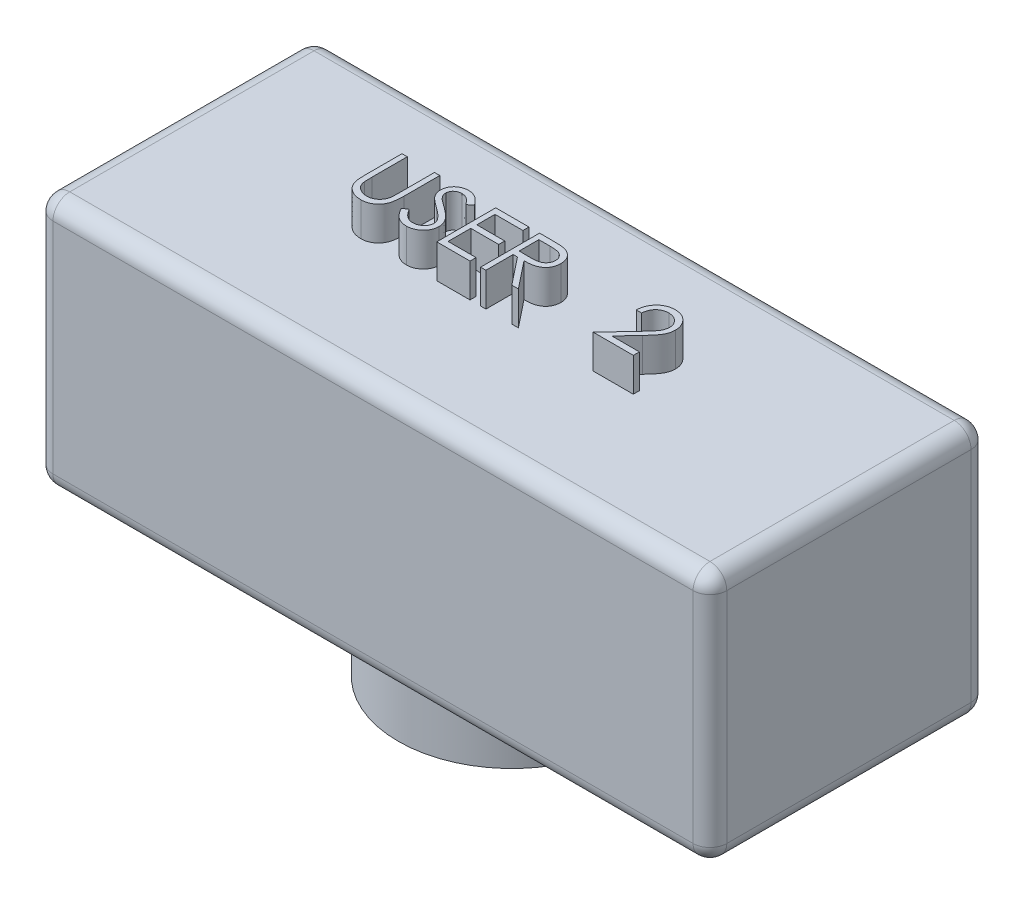
from build123d import *

# Parameters (mm, degrees)
SKETCH1_R           = 5.75
BOSS_EXTRUDE1_DEPTH = 4.5
SKETCH2_W           = 40
SKETCH2_H           = 16.5
BOSS_EXTRUDE2_DEPTH = 15
SKETCH3_R           = 6.75
BOSS_EXTRUDE3_DEPTH = 4
SKETCH5_R           = 5.75
CUT_EXTRUDE1_DEPTH  = 4
FILLET1_R           = 1
BOSS_EXTRUDE5_DEPTH = 2
FILLET2_R           = 1


with BuildPart() as part:
    # Sketch1 → Boss-Extrude1 (new body)
    with BuildSketch(Plane(origin=(0, 0, 0), x_dir=(1, 0, 0), z_dir=(0, 1, 0))):
        with Locations(Location((0, 0, 0), (0, 0, 270))):
            Circle(SKETCH1_R)
    extrude(amount=BOSS_EXTRUDE1_DEPTH)

    # Sketch2 → Boss-Extrude2 (add)
    with BuildSketch(Plane(origin=(0, 4.5, 0), x_dir=(1, 0, 0), z_dir=(0, 1, 0))):
        Rectangle(SKETCH2_W, SKETCH2_H)
    extrude(amount=BOSS_EXTRUDE2_DEPTH)

    # Sketch3 → Boss-Extrude3 (add)
    with BuildSketch(Plane.XZ.offset(-4.5)):
        with Locations(Location((0, 0, 0), (0, 0, 90))):
            Circle(SKETCH3_R)
    extrude(amount=BOSS_EXTRUDE3_DEPTH)

    # Sketch5 → Cut-Extrude1 (cut)
    with BuildSketch(Plane.XZ):
        with Locations(Location((0, 0, 0), (0, 0, 270))):
            Circle(SKETCH5_R)
    extrude(amount=-CUT_EXTRUDE1_DEPTH, mode=Mode.SUBTRACT)

    # Fillet1
    fillet1_edges = [part.edges().sort_by_distance(p)[0] for p in [
        (20, 19.5, 0),
        (0, 19.5, -8.25),
        (-20, 19.5, 0),
        (0, 19.5, 8.25),
    ]]
    fillet(fillet1_edges, radius=FILLET1_R)

    # Sketch9 → Boss-Extrude5 (add)
    # profile 1 of 5: a face of its own
    with BuildSketch(Plane(origin=(0, 19.5, 0), x_dir=(1, 0, 0), z_dir=(0, 1, 0))):
        with BuildLine():
            Line((-9.101327965, 2.570923135), (-8.787225401, 2.570923135))
            Line((-8.787225401, 2.570923135), (-8.787225401, 0.473867847))
            add(Edge.make_bspline(
                [(-8.787225401, 0.473867847), (-8.787272145, 0.444187111), (-8.78736085, 0.3878628), (-8.786768336, 0.307694499), (-8.785108967, 0.23642204), (-8.784062808, 0.173770693), (-8.781735474, 0.120027945), (-8.779837427, 0.074902635), (-8.777396871, 0.038608432), (-8.774463753, 0.017427506), (-8.773202965, 0.008322975)],
                knots=[0, 0, 0, 0, 1.528628734, 2.90083645, 4.128790002, 5.200304208, 6.127813768, 6.898992206, 7.526736466, 8, 8, 8, 8], degree=3))
            add(Edge.make_bspline(
                [(-8.773202965, 0.008322975), (-8.768025506, -0.024523789), (-8.75796232, -0.088366518), (-8.732315942, -0.179274799), (-8.696498441, -0.261206258), (-8.654055398, -0.336717549), (-8.598122787, -0.403706909), (-8.531119252, -0.465418562), (-8.449941483, -0.519390366), (-8.359680877, -0.568741178), (-8.26239564, -0.608406261), (-8.162984374, -0.638399625), (-8.062941394, -0.656678525), (-7.995965229, -0.658795064), (-7.96270617, -0.659846096)],
                knots=[0, 0, 0, 0, 1.035780045, 2.013197591, 2.933192213, 3.817615948, 4.702609284, 5.640816605, 6.646850145, 7.73207398, 8.84249596, 9.914020372, 10.964143139, 12, 12, 12, 12], degree=3))
            add(Edge.make_bspline(
                [(-7.96270617, -0.659846096), (-7.93415243, -0.658772245), (-7.877209868, -0.656630747), (-7.792603437, -0.643369316), (-7.710203328, -0.61946875), (-7.629602649, -0.588628992), (-7.554051664, -0.547881401), (-7.483508222, -0.500810561), (-7.420544288, -0.445599685), (-7.36308629, -0.384499341), (-7.313051354, -0.315559541), (-7.269680213, -0.240281403), (-7.234154283, -0.157532056), (-7.216610758, -0.099377634), (-7.207597997, -0.069501544)],
                knots=[0, 0, 0, 0, 0.994687771, 1.983630487, 2.973142513, 3.978332533, 4.983357753, 5.956394766, 6.925816176, 7.893390482, 8.871859704, 9.88551698, 10.913711441, 12, 12, 12, 12], degree=3))
            add(Edge.make_bspline(
                [(-7.207597997, -0.069501544), (-7.204597872, -0.05715297), (-7.197912384, -0.02963537), (-7.191665339, 0.016885921), (-7.185158813, 0.071775285), (-7.180644243, 0.135427097), (-7.176243023, 0.20762807), (-7.17360995, 0.288754327), (-7.172392917, 0.378511288), (-7.172030237, 0.44114845), (-7.171840785, 0.473867847)],
                knots=[0, 0, 0, 0, 0.558680831, 1.244966039, 2.062412453, 2.990489873, 4.051219941, 5.244515665, 6.560634259, 8, 8, 8, 8], degree=3))
            Line((-7.171840785, 0.473867847), (-7.171840785, 2.570923135))
            Line((-7.171840785, 2.570923135), (-6.857738221, 2.570923135))
            Line((-6.857738221, 2.570923135), (-6.857738221, 0.457040924))
            add(Edge.make_bspline(
                [(-6.857738221, 0.457040924), (-6.857992342, 0.418942545), (-6.858488273, 0.344591242), (-6.86278885, 0.235639883), (-6.869645849, 0.132286901), (-6.879333937, 0.034518405), (-6.892170941, -0.057315754), (-6.906446161, -0.144020523), (-6.924625694, -0.224973515), (-6.945859095, -0.300805933), (-6.970132643, -0.372991446), (-7.001573792, -0.441500061), (-7.036998292, -0.508414461), (-7.079012945, -0.572722569), (-7.126224327, -0.634709123), (-7.179676008, -0.693998198), (-7.237600169, -0.751537244), (-7.300959728, -0.80585031), (-7.368710254, -0.855658987), (-7.440650211, -0.899456758), (-7.516226981, -0.936480375), (-7.595244107, -0.9669563), (-7.67773531, -0.989870899), (-7.76370267, -1.006946055), (-7.853341863, -1.016648352), (-7.914306519, -1.018090282), (-7.945178125, -1.018820455)],
                knots=[0, 0, 0, 0, 1.316592851, 2.569410997, 3.76748051, 4.895814652, 5.963796859, 6.97159953, 7.931736103, 8.829262218, 9.692595152, 10.560224239, 11.431080259, 12.30701507, 13.211635791, 14.121146779, 15.063487852, 16.031507147, 17.00238618, 17.966455255, 18.938106653, 19.907068911, 20.888905087, 21.893141452, 22.933117798, 24, 24, 24, 24], degree=3))
            add(Edge.make_bspline(
                [(-7.945178125, -1.018820455), (-7.978847228, -1.018035689), (-8.044905887, -1.016495983), (-8.142243954, -1.007673233), (-8.23555815, -0.991054838), (-8.325834027, -0.969894895), (-8.411842524, -0.940711157), (-8.494735969, -0.906613032), (-8.57309465, -0.864735772), (-8.648189779, -0.818142379), (-8.718014535, -0.765717741), (-8.782111938, -0.708577567), (-8.840587808, -0.64763719), (-8.892456505, -0.582236824), (-8.938577389, -0.512885117), (-8.978307603, -0.439385877), (-9.012420847, -0.361767561), (-9.030027414, -0.30781436), (-9.038928125, -0.280539205)],
                knots=[0, 0, 0, 0, 1.13879206, 2.234305948, 3.301075583, 4.341971843, 5.366689343, 6.369221514, 7.369726634, 8.367512178, 9.355451585, 10.318319045, 11.268648973, 12.207971039, 13.137398894, 14.081662264, 15.030215811, 16, 16, 16, 16], degree=3))
            add(Edge.make_bspline(
                [(-9.038928125, -0.280539205), (-9.044105283, -0.26190663), (-9.055334655, -0.221492161), (-9.067359952, -0.154605673), (-9.077469034, -0.077590755), (-9.086974592, 0.009557863), (-9.09258355, 0.10690773), (-9.097500989, 0.214416646), (-9.101362608, 0.332214607), (-9.101339835, 0.414269123), (-9.101327965, 0.457040924)],
                knots=[0, 0, 0, 0, 0.625038921, 1.35572334, 2.194682327, 3.136881307, 4.189498639, 5.346923369, 6.617055217, 8, 8, 8, 8], degree=3))
            Line((-9.101327965, 0.457040924), (-9.101327965, 2.570923135))
        make_face()
    # profile 2 of 5: a face of its own
    with BuildSketch(Plane(origin=(0, 19.5, 0), x_dir=(1, 0, 0), z_dir=(0, 1, 0))):
        with BuildLine():
            Line((-6.319276683, -0.253896576), (-6.023403285, -0.076512762))
            add(Edge.make_bspline(
                [(-6.023403285, -0.076512762), (-5.995885048, -0.122577147), (-5.943161168, -0.210834731), (-5.855209808, -0.330092772), (-5.764076897, -0.431454928), (-5.669087564, -0.514331536), (-5.570821616, -0.579580423), (-5.468637562, -0.625782654), (-5.362879751, -0.65459863), (-5.29090593, -0.658098716), (-5.254973798, -0.659846096)],
                knots=[0, 0, 0, 0, 1.272034388, 2.437168799, 3.508375237, 4.49857839, 5.41946034, 6.295179144, 7.148887113, 8, 8, 8, 8], degree=3))
            add(Edge.make_bspline(
                [(-5.254973798, -0.659846096), (-5.224286938, -0.658991423), (-5.163450165, -0.657297033), (-5.073887922, -0.641016231), (-4.98690612, -0.616004102), (-4.904297482, -0.58018317), (-4.827201867, -0.536844685), (-4.759595172, -0.484498507), (-4.701149059, -0.425892301), (-4.653339944, -0.360509647), (-4.616659909, -0.290192498), (-4.58846784, -0.218016547), (-4.572822767, -0.142847979), (-4.570466013, -0.092237516), (-4.569276683, -0.066697057)],
                knots=[0, 0, 0, 0, 1.095163259, 2.171163733, 3.241058638, 4.321873601, 5.38011039, 6.391990106, 7.366004449, 8.327778327, 9.272591725, 10.192022065, 11.087607919, 12, 12, 12, 12], degree=3))
            add(Edge.make_bspline(
                [(-4.569276683, -0.066697057), (-4.570750994, -0.037556208), (-4.573748052, 0.021682882), (-4.599079532, 0.109082535), (-4.638928779, 0.195575105), (-4.675691422, 0.24907637), (-4.694777484, 0.276852622)],
                knots=[0, 0, 0, 0, 0.938893495, 1.908633276, 2.914225137, 4, 4, 4, 4], degree=3))
            add(Edge.make_bspline(
                [(-4.694777484, 0.276852622), (-4.710448098, 0.296899446), (-4.743346593, 0.338985244), (-4.799904105, 0.40163048), (-4.86627022, 0.466248899), (-4.940173774, 0.535307956), (-5.024306863, 0.605595753), (-5.116034378, 0.68046403), (-5.217698237, 0.757065607), (-5.288997733, 0.808438173), (-5.3257871, 0.834945571)],
                knots=[0, 0, 0, 0, 0.722233717, 1.516239348, 2.393582979, 3.351407094, 4.387010283, 5.505090956, 6.712668013, 8, 8, 8, 8], degree=3))
            add(Edge.make_bspline(
                [(-5.3257871, 0.834945571), (-5.362611096, 0.861174159), (-5.433015772, 0.911321221), (-5.531474355, 0.985745505), (-5.619518818, 1.053789374), (-5.696757834, 1.116093387), (-5.763157431, 1.172665991), (-5.819240842, 1.22296393), (-5.863579399, 1.268347491), (-5.88823498, 1.297788833), (-5.899304728, 1.31100727)],
                knots=[0, 0, 0, 0, 1.452282411, 2.77665338, 3.964542531, 5.026858415, 5.96415736, 6.766646006, 7.446254459, 8, 8, 8, 8], degree=3))
            add(Edge.make_bspline(
                [(-5.899304728, 1.31100727), (-5.914777273, 1.331608307), (-5.94520611, 1.37212301), (-5.985372115, 1.435447868), (-6.019511278, 1.500271134), (-6.04627361, 1.566766998), (-6.068809829, 1.634001927), (-6.08396776, 1.702853173), (-6.093459157, 1.773011791), (-6.094431143, 1.820225292), (-6.094917709, 1.843859834)],
                knots=[0, 0, 0, 0, 1.068054152, 2.10047183, 3.106115577, 4.101338837, 5.06977816, 6.043150881, 7.020423561, 8, 8, 8, 8], degree=3))
            add(Edge.make_bspline(
                [(-6.094917709, 1.843859834), (-6.0936125, 1.880889608), (-6.091029979, 1.954157672), (-6.069189462, 2.061188503), (-6.034716569, 2.16337492), (-5.986421681, 2.259705253), (-5.924164328, 2.347671234), (-5.852118353, 2.428284721), (-5.766306867, 2.496053304), (-5.672154244, 2.555265362), (-5.569097872, 2.601611287), (-5.461106968, 2.636572267), (-5.348009896, 2.656381525), (-5.271406762, 2.65922429), (-5.232537901, 2.660666725)],
                knots=[0, 0, 0, 0, 1.005424448, 1.989358655, 2.955360095, 3.929531133, 4.905563448, 5.876582895, 6.856512386, 7.866279853, 8.892233794, 9.918561126, 10.94386622, 12, 12, 12, 12], degree=3))
            add(Edge.make_bspline(
                [(-5.232537901, 2.660666725), (-5.191293801, 2.659244173), (-5.109272449, 2.656415172), (-4.988623233, 2.631817641), (-4.872462517, 2.591116969), (-4.779019252, 2.544928311), (-4.705886491, 2.498796895), (-4.650113758, 2.456777071), (-4.593596307, 2.408401962), (-4.535878252, 2.353542716), (-4.477937593, 2.291695965), (-4.418914141, 2.223285276), (-4.358669872, 2.148728721), (-4.319914012, 2.09550422), (-4.300045914, 2.068218808)],
                knots=[0, 0, 0, 0, 1.286793592, 2.559021753, 3.825965368, 5.121522368, 5.803751409, 6.523245864, 7.299691795, 8.125521123, 9.008227632, 9.944561021, 10.946284179, 12, 12, 12, 12], degree=3))
            Line((-4.300045914, 2.068218808), (-4.584000241, 1.852974417))
            add(Edge.make_bspline(
                [(-4.584000241, 1.852974417), (-4.601146173, 1.875063108), (-4.63416523, 1.917600761), (-4.684294717, 1.977172076), (-4.731543365, 2.031588556), (-4.778093765, 2.078853684), (-4.821487396, 2.121555817), (-4.863604438, 2.158115574), (-4.90383879, 2.18889117), (-4.9545557, 2.22173473), (-5.018273419, 2.254291233), (-5.098257955, 2.281840311), (-5.18184423, 2.298395373), (-5.238773861, 2.300584261), (-5.267593991, 2.301692366)],
                knots=[0, 0, 0, 0, 1.181633172, 2.275549214, 3.290209073, 4.226197932, 5.078386478, 5.862611352, 6.581680152, 7.217281963, 8.414376989, 9.595101626, 10.782541182, 12, 12, 12, 12], degree=3))
            add(Edge.make_bspline(
                [(-5.267593991, 2.301692366), (-5.303750513, 2.300480666), (-5.37347496, 2.298144017), (-5.472465197, 2.272624031), (-5.561559122, 2.232442171), (-5.638111687, 2.176127193), (-5.701848664, 2.1094062), (-5.747954122, 2.032627345), (-5.775704287, 1.947844943), (-5.779090567, 1.888703286), (-5.780815144, 1.858583392)],
                knots=[0, 0, 0, 0, 1.14458467, 2.207223713, 3.21896685, 4.227309161, 5.202851033, 6.127160689, 7.046193047, 8, 8, 8, 8], degree=3))
            add(Edge.make_bspline(
                [(-5.780815144, 1.858583392), (-5.780422018, 1.839831913), (-5.779635122, 1.802298294), (-5.768660324, 1.746846872), (-5.754560995, 1.691535532), (-5.732218363, 1.636612949), (-5.70137306, 1.58111859), (-5.660867884, 1.524096853), (-5.609854572, 1.465045144), (-5.570777559, 1.42663777), (-5.550146074, 1.406359834)],
                knots=[0, 0, 0, 0, 0.858281714, 1.717966888, 2.583508476, 3.4729293, 4.427298488, 5.488583878, 6.674047936, 8, 8, 8, 8], degree=3))
            add(Edge.make_bspline(
                [(-5.550146074, 1.406359834), (-5.542484702, 1.399522808), (-5.524283034, 1.3832796), (-5.491007109, 1.356687319), (-5.44706431, 1.323884547), (-5.393602109, 1.28329723), (-5.329634748, 1.236215768), (-5.255155191, 1.183242156), (-5.170993659, 1.122656697), (-5.111271743, 1.080299156), (-5.07969335, 1.057902302)],
                knots=[0, 0, 0, 0, 0.420754252, 0.999615792, 1.744751191, 2.668019286, 3.750313428, 4.999500688, 6.413464383, 8, 8, 8, 8], degree=3))
            add(Edge.make_bspline(
                [(-5.07969335, 1.057902302), (-5.041707436, 1.030260942), (-4.96815298, 0.97673728), (-4.8634954, 0.8963216), (-4.768601592, 0.817673832), (-4.683138388, 0.741296225), (-4.60626148, 0.667768132), (-4.538823759, 0.596204951), (-4.480138079, 0.527119379), (-4.41695886, 0.438546803), (-4.352401041, 0.329765719), (-4.296959533, 0.19648748), (-4.262001186, 0.06269116), (-4.257429671, -0.027235677), (-4.255174119, -0.07160491)],
                knots=[0, 0, 0, 0, 1.163667725, 2.253281268, 3.268753668, 4.215851969, 5.092017293, 5.902905408, 6.650798638, 7.335211899, 8.59617414, 9.77448103, 10.901945474, 12, 12, 12, 12], degree=3))
            add(Edge.make_bspline(
                [(-4.255174119, -0.07160491), (-4.255831257, -0.102983275), (-4.257132772, -0.165130658), (-4.272093686, -0.256385735), (-4.294013351, -0.345016605), (-4.327050585, -0.429927717), (-4.367373743, -0.51267248), (-4.418539991, -0.591080381), (-4.477847676, -0.666886779), (-4.545881441, -0.73807027), (-4.620327343, -0.803416466), (-4.699011038, -0.861545528), (-4.782061311, -0.910013851), (-4.869027627, -0.949564693), (-4.959929964, -0.980498211), (-5.054737748, -1.00291108), (-5.153607259, -1.016666791), (-5.220807741, -1.018094552), (-5.254973798, -1.018820455)],
                knots=[0, 0, 0, 0, 0.983748083, 1.948392443, 2.894712957, 3.844097841, 4.80183111, 5.778335162, 6.776009319, 7.81870978, 8.863265674, 9.881300176, 10.883814829, 11.87499822, 12.874611388, 13.892143829, 14.928324115, 16, 16, 16, 16], degree=3))
            add(Edge.make_bspline(
                [(-5.254973798, -1.018820455), (-5.281409141, -1.018309273), (-5.333946901, -1.017293348), (-5.411656383, -1.008312067), (-5.487795972, -0.995604964), (-5.561410254, -0.975430894), (-5.633447666, -0.950953917), (-5.703594901, -0.920815584), (-5.771885954, -0.884698383), (-5.838703537, -0.843403358), (-5.903877712, -0.795345613), (-5.96679718, -0.739372117), (-6.029526365, -0.677026612), (-6.090213762, -0.606616049), (-6.150086906, -0.529277966), (-6.207965316, -0.444288782), (-6.265047033, -0.352111429), (-6.300862501, -0.287246343), (-6.319276683, -0.253896576)],
                knots=[0, 0, 0, 0, 0.915332311, 1.819136955, 2.706846663, 3.586547465, 4.459518054, 5.340707479, 6.227863349, 7.133153174, 8.059268498, 9.028702269, 10.047606654, 11.120612155, 12.245963614, 13.433783089, 14.680604001, 16, 16, 16, 16], degree=3))
        make_face()
    # profile 3 of 5: a face of its own
    with BuildSketch(Plane(origin=(0, 19.5, 0), x_dir=(1, 0, 0), z_dir=(0, 1, 0))):
        Polygon((-3.537225401, 2.570923135), (-1.562866427, 2.570923135), (-1.562866427, 2.211948776), (-3.223122837, 2.211948776), (-3.223122837, 1.135025699), (-1.562866427, 1.135025699), (-1.562866427, 0.77605134), (-3.223122837, 0.77605134), (-3.223122837, -0.570102506), (-1.562866427, -0.570102506), (-1.562866427, -0.929076865), (-3.537225401, -0.929076865), align=None)
    # profile 4 of 5: a face of its own
    with BuildSketch(Plane(origin=(0, 19.5, 0), x_dir=(1, 0, 0), z_dir=(0, 1, 0))):
        with BuildLine():
            Line((-0.934661298, 2.570923135), (-0.234240625, 2.570923135))
            add(Edge.make_bspline(
                [(-0.234240625, 2.570923135), (-0.187499497, 2.570767549), (-0.097751352, 2.570468807), (0.030821918, 2.568803044), (0.147649015, 2.564028688), (0.252668854, 2.559920105), (0.345879509, 2.552428163), (0.4275668, 2.545267516), (0.497354498, 2.535893855), (0.539600349, 2.527188432), (0.558728125, 2.523246853)],
                knots=[0, 0, 0, 0, 1.410062039, 2.707475311, 3.878576406, 4.937260626, 5.877586885, 6.699081471, 7.410979367, 8, 8, 8, 8], degree=3))
            add(Edge.make_bspline(
                [(0.558728125, 2.523246853), (0.584334749, 2.516920088), (0.635001738, 2.504401524), (0.707951804, 2.477941923), (0.777466128, 2.447322299), (0.843255953, 2.411358578), (0.904991744, 2.369783799), (0.963310055, 2.323315676), (1.018475518, 2.27220847), (1.068257148, 2.215173629), (1.1151962, 2.155337119), (1.154784826, 2.090633362), (1.188911306, 2.022971835), (1.216081823, 1.951664417), (1.237959797, 1.877402645), (1.253386036, 1.799513848), (1.262637224, 1.718352873), (1.263579079, 1.662994965), (1.26405665, 1.634925539)],
                knots=[0, 0, 0, 0, 1.027469482, 2.033020251, 3.019912614, 3.986113645, 4.951240523, 5.91722682, 6.890402269, 7.87763091, 8.8651537, 9.85103654, 10.82876324, 11.815024772, 12.821070561, 13.842952187, 14.906261191, 16, 16, 16, 16], degree=3))
            add(Edge.make_bspline(
                [(1.26405665, 1.634925539), (1.262587652, 1.588290434), (1.259721257, 1.497293266), (1.232996153, 1.365232385), (1.189219633, 1.24204307), (1.128896344, 1.127880432), (1.052076868, 1.024969787), (0.959752077, 0.934579332), (0.851870466, 0.858939419), (0.75144115, 0.806486615), (0.66272695, 0.772893706), (0.589693637, 0.749257347), (0.51002666, 0.730995382), (0.424489325, 0.71463525), (0.33272567, 0.702283556), (0.23495563, 0.693236961), (0.131109479, 0.687582912), (0.059770409, 0.686740908), (0.023071073, 0.68630775)],
                knots=[0, 0, 0, 0, 1.260483769, 2.459530307, 3.627416485, 4.787058657, 5.939039949, 7.08810263, 8.267026773, 9.491475466, 10.141966685, 10.831826277, 11.566392101, 12.351337768, 13.187381173, 14.07005841, 15.007169909, 16, 16, 16, 16], degree=3))
            Line((0.023071073, 0.68630775), (1.308928445, -0.929076865))
            Line((1.308928445, -0.929076865), (0.920506971, -0.929076865))
            Line((0.920506971, -0.929076865), (-0.365350401, 0.68630775))
            Line((-0.365350401, 0.68630775), (-0.620558734, 0.68630775))
            Line((-0.620558734, 0.68630775), (-0.620558734, -0.929076865))
            Line((-0.620558734, -0.929076865), (-0.934661298, -0.929076865))
            Line((-0.934661298, -0.929076865), (-0.934661298, 2.570923135))
        make_face()
        with BuildLine():
            Line((-0.620558734, 2.211948776), (-0.620558734, 1.045282109))
            Line((-0.620558734, 1.045282109), (0.020266586, 1.040374257))
            add(Edge.make_bspline(
                [(0.020266586, 1.040374257), (0.050186625, 1.04036102), (0.108180182, 1.040335364), (0.192080847, 1.04432914), (0.270200959, 1.048872458), (0.342241711, 1.055821804), (0.408235286, 1.064777876), (0.4681487, 1.07598086), (0.522079751, 1.089032922), (0.58497829, 1.109234548), (0.655214821, 1.141240567), (0.731546281, 1.187806065), (0.796548619, 1.246375184), (0.851466481, 1.31334864), (0.895595913, 1.386984889), (0.926707967, 1.466401258), (0.946450409, 1.549592856), (0.948778955, 1.606770964), (0.949954086, 1.635626661)],
                knots=[0, 0, 0, 0, 1.146690395, 2.22261258, 3.21895312, 4.145990853, 4.996080663, 5.770904154, 6.481378293, 7.121626537, 8.300444488, 9.431385265, 10.535395872, 11.636531494, 12.74115979, 13.810798291, 14.895190096, 16, 16, 16, 16], degree=3))
            add(Edge.make_bspline(
                [(0.949954086, 1.635626661), (0.948751965, 1.663773234), (0.9463698, 1.719549473), (0.926921031, 1.801205383), (0.89403165, 1.878272334), (0.849709412, 1.950436819), (0.795710257, 2.015942554), (0.732392444, 2.071989707), (0.661487249, 2.118239172), (0.595216051, 2.147793553), (0.535981838, 2.165913406), (0.484552178, 2.17866457), (0.426440701, 2.188909039), (0.361365242, 2.1971171), (0.289603611, 2.204172044), (0.21079296, 2.208923822), (0.12545618, 2.211737687), (0.066309249, 2.211876775), (0.035691266, 2.211948776)],
                knots=[0, 0, 0, 0, 1.101028733, 2.181837193, 3.264309656, 4.369019818, 5.486613113, 6.575447106, 7.666700264, 8.788928104, 9.402425223, 10.0903467, 10.862060571, 11.710948788, 12.657782767, 13.684531032, 14.801375019, 16, 16, 16, 16], degree=3))
            Line((0.035691266, 2.211948776), (-0.620558734, 2.211948776))
        make_face(mode=Mode.SUBTRACT)
    # profile 5 of 5: a face of its own
    with BuildSketch(Plane(origin=(0, 19.5, 0), x_dir=(1, 0, 0), z_dir=(0, 1, 0))):
        with BuildLine():
            Line((6.199954086, 1.494000058), (5.885851522, 1.494000058))
            add(Edge.make_bspline(
                [(5.885851522, 1.494000058), (5.887898675, 1.535670946), (5.891919229, 1.617511461), (5.910747519, 1.736835367), (5.937688396, 1.850890166), (5.97577985, 1.95876008), (6.023086128, 2.061398887), (6.079816155, 2.158398903), (6.147010005, 2.249390091), (6.223216739, 2.333528935), (6.305985378, 2.410716505), (6.395291318, 2.477371748), (6.489136345, 2.53368942), (6.587235744, 2.580770661), (6.690696308, 2.616110507), (6.798579166, 2.642332147), (6.911358302, 2.658108493), (6.988198324, 2.659804278), (7.027277804, 2.660666725)],
                knots=[0, 0, 0, 0, 1.10065271, 2.161652631, 3.183658789, 4.190468796, 5.17591951, 6.163126047, 7.15150782, 8.156236427, 9.156009102, 10.134482811, 11.092018607, 12.041330605, 13.001268258, 13.972401359, 14.968799086, 16, 16, 16, 16], degree=3))
            add(Edge.make_bspline(
                [(7.027277804, 2.660666725), (7.065655878, 2.659768268), (7.141067423, 2.658002834), (7.251129437, 2.642841804), (7.355906732, 2.619096213), (7.455194498, 2.585780796), (7.548200563, 2.540996369), (7.635623608, 2.48719883), (7.718504418, 2.424978999), (7.793111202, 2.351725185), (7.861619281, 2.273522801), (7.920721536, 2.190034897), (7.9713347, 2.103805612), (8.01352238, 2.01417741), (8.044578519, 1.920306382), (8.068156727, 1.823559179), (8.08148414, 1.722934368), (8.083529564, 1.654827812), (8.084569471, 1.620201981)],
                knots=[0, 0, 0, 0, 1.111607364, 2.184268762, 3.212621178, 4.221274766, 5.211760367, 6.196651075, 7.1921475, 8.207485113, 9.220403448, 10.201281604, 11.166441695, 12.114753415, 13.065576456, 14.026450734, 14.996634279, 16, 16, 16, 16], degree=3))
            add(Edge.make_bspline(
                [(8.084569471, 1.620201981), (8.082876208, 1.571454147), (8.079519397, 1.474813933), (8.05080502, 1.33279907), (8.005958509, 1.195205651), (7.951961152, 1.084468349), (7.897488708, 0.995234855), (7.848401201, 0.92176615), (7.79093639, 0.842660682), (7.724257892, 0.758183345), (7.649745019, 0.66767244), (7.566722856, 0.571182644), (7.474599374, 0.469710874), (7.409940873, 0.400405273), (7.376436458, 0.364492847)],
                knots=[0, 0, 0, 0, 1.184426356, 2.348067706, 3.509069118, 4.696110526, 5.333549288, 6.050745305, 6.844228056, 7.710549037, 8.667450064, 9.695053472, 10.805634456, 12, 12, 12, 12], degree=3))
            Line((7.376436458, 0.364492847), (6.500735336, -0.570102506))
            Line((6.500735336, -0.570102506), (8.129441266, -0.570102506))
            Line((8.129441266, -0.570102506), (8.129441266, -0.929076865))
            Line((8.129441266, -0.929076865), (5.751236138, -0.929076865))
            Line((5.751236138, -0.929076865), (7.108607932, 0.519440763))
            add(Edge.make_bspline(
                [(7.108607932, 0.519440763), (7.141655819, 0.55393907), (7.205134046, 0.620203256), (7.294916623, 0.716946217), (7.375555612, 0.806695757), (7.447573004, 0.889282306), (7.50940651, 0.965913874), (7.564278742, 1.034108577), (7.608244333, 1.096863027), (7.655959728, 1.169603641), (7.70217371, 1.258415959), (7.741886066, 1.366949648), (7.766100914, 1.4786769), (7.76900575, 1.554178938), (7.770466907, 1.592157109)],
                knots=[0, 0, 0, 0, 1.329631726, 2.553950428, 3.673215718, 4.687767853, 5.603093632, 6.413772471, 7.123043292, 7.734684054, 8.834405432, 9.900288307, 10.943827018, 12, 12, 12, 12], degree=3))
            add(Edge.make_bspline(
                [(7.770466907, 1.592157109), (7.769831165, 1.616038508), (7.768578239, 1.663104158), (7.757520541, 1.732109917), (7.740810035, 1.798674731), (7.716864777, 1.86300335), (7.685258037, 1.924449002), (7.646784657, 1.983086482), (7.602394593, 2.039775448), (7.551043324, 2.092928746), (7.494631804, 2.141609951), (7.435037555, 2.184734037), (7.37198745, 2.220773147), (7.305747328, 2.250316645), (7.236501859, 2.273492026), (7.164117114, 2.289550605), (7.088793098, 2.299633089), (7.037359602, 2.300997261), (7.011152003, 2.301692366)],
                knots=[0, 0, 0, 0, 0.991446411, 1.95395049, 2.89581595, 3.838931463, 4.798493298, 5.75982156, 6.748411868, 7.785213223, 8.824556874, 9.840280684, 10.836137867, 11.835679398, 12.848801643, 13.863922112, 14.911575587, 16, 16, 16, 16], degree=3))
            add(Edge.make_bspline(
                [(7.011152003, 2.301692366), (6.98378117, 2.300977334), (6.930029374, 2.299573128), (6.851110341, 2.289750464), (6.775824564, 2.272804624), (6.703982661, 2.24962795), (6.635463075, 2.220169401), (6.570599031, 2.183477656), (6.509536141, 2.139694163), (6.452159618, 2.090053607), (6.399295639, 2.034786005), (6.352848763, 1.973176042), (6.312264749, 1.906348627), (6.276855516, 1.834484076), (6.248099826, 1.756930296), (6.226126675, 1.673962591), (6.208739828, 1.58594121), (6.202931308, 1.525156125), (6.199954086, 1.494000058)],
                knots=[0, 0, 0, 0, 1.031018746, 2.02475058, 2.990194455, 3.934040569, 4.864654155, 5.795059489, 6.735614925, 7.690564532, 8.649604399, 9.611025574, 10.590972636, 11.591080095, 12.624614302, 13.701020113, 14.821632451, 16, 16, 16, 16], degree=3))
        make_face()
    extrude(amount=BOSS_EXTRUDE5_DEPTH)

    # Fillet2
    # the kernel refuses this fillet: 1 mm, written as the material it takes off along each edge
    with BuildSketch(Plane(origin=(-19, 18.5, 7.25), x_dir=(0, 0, 1), z_dir=(-1, 0, 0))) as fillet2_piece_1_section:
        Polygon((0, 0), (FILLET2_R, 0), (FILLET2_R, FILLET2_R), (0, FILLET2_R), align=None)
    fillet2_piece_1 = extrude(amount=FILLET2_R, mode=Mode.PRIVATE)
    fillet2_piece_1 = fillet2_piece_1 - Plane(origin=(-19, 18.5, 7.25), x_dir=(0, -0.7071067811865475, -0.7071067811865475), z_dir=(-1, 0, 0)) * Sphere(FILLET2_R, mode=Mode.PRIVATE)
    add(fillet2_piece_1, mode=Mode.SUBTRACT)
    with BuildSketch(Plane(origin=(-19, 18.5, -7.25), x_dir=(-1, 0, 0), z_dir=(0, 0, -1))) as fillet2_piece_2_section:
        Polygon((0, 0), (FILLET2_R, 0), (FILLET2_R, FILLET2_R), (0, FILLET2_R), align=None)
    fillet2_piece_2 = extrude(amount=FILLET2_R, mode=Mode.PRIVATE)
    fillet2_piece_2 = fillet2_piece_2 - Plane(origin=(-19, 18.5, -7.25), x_dir=(0.7071067811865475, -0.7071067811865475, 0), z_dir=(0, 0, -1)) * Sphere(FILLET2_R, mode=Mode.PRIVATE)
    add(fillet2_piece_2, mode=Mode.SUBTRACT)
    with BuildSketch(Plane(origin=(19, 18.5, 7.25), x_dir=(0, 0, 1), z_dir=(1, 0, 0))) as fillet2_piece_3_section:
        Polygon((0, 0), (FILLET2_R, 0), (FILLET2_R, -FILLET2_R), (0, -FILLET2_R), align=None)
    fillet2_piece_3 = extrude(amount=FILLET2_R, mode=Mode.PRIVATE)
    fillet2_piece_3 = fillet2_piece_3 - Plane(origin=(19, 18.5, 7.25), x_dir=(0, -0.7071067811865475, -0.7071067811865475), z_dir=(1, 0, 0)) * Sphere(FILLET2_R, mode=Mode.PRIVATE)
    add(fillet2_piece_3, mode=Mode.SUBTRACT)
    with BuildSketch(Plane(origin=(19, 18.5, -7.25), x_dir=(1, 0, 0), z_dir=(0, 0, -1))) as fillet2_piece_4_section:
        Polygon((0, 0), (FILLET2_R, 0), (FILLET2_R, -FILLET2_R), (0, -FILLET2_R), align=None)
    fillet2_piece_4 = extrude(amount=FILLET2_R, mode=Mode.PRIVATE)
    fillet2_piece_4 = fillet2_piece_4 - Plane(origin=(19, 18.5, -7.25), x_dir=(-0.7071067811865475, -0.7071067811865475, 0), z_dir=(0, 0, -1)) * Sphere(FILLET2_R, mode=Mode.PRIVATE)
    add(fillet2_piece_4, mode=Mode.SUBTRACT)
    with BuildSketch(Plane(origin=(19, 5.5, -7.25), x_dir=(0, -1, 0), z_dir=(0, 0, -1))) as fillet2_piece_5_section:
        Polygon((0, 0), (FILLET2_R, 0), (FILLET2_R, -FILLET2_R), (0, -FILLET2_R), align=None)
    fillet2_piece_5 = extrude(amount=FILLET2_R, mode=Mode.PRIVATE)
    fillet2_piece_5 = fillet2_piece_5 - Plane(origin=(19, 5.5, -7.25), x_dir=(-0.7071067811865475, 0.7071067811865475, 0), z_dir=(0, 0, -1)) * Sphere(FILLET2_R, mode=Mode.PRIVATE)
    add(fillet2_piece_5, mode=Mode.SUBTRACT)
    with BuildSketch(Plane(origin=(19, 5.5, 7.25), x_dir=(1, 0, 0), z_dir=(0, -1, 0))) as fillet2_piece_6_section:
        Polygon((0, 0), (FILLET2_R, 0), (FILLET2_R, FILLET2_R), (0, FILLET2_R), align=None)
    fillet2_piece_6 = extrude(amount=FILLET2_R, mode=Mode.PRIVATE)
    fillet2_piece_6 = fillet2_piece_6 - Plane(origin=(19, 5.5, 7.25), x_dir=(-0.7071067811865475, 0, -0.7071067811865475), z_dir=(0, -1, 0)) * Sphere(FILLET2_R, mode=Mode.PRIVATE)
    add(fillet2_piece_6, mode=Mode.SUBTRACT)
    with BuildSketch(Plane(origin=(-19, 5.5, 7.25), x_dir=(0, -1, 0), z_dir=(-1, 0, 0))) as fillet2_piece_7_section:
        Polygon((0, 0), (FILLET2_R, 0), (FILLET2_R, FILLET2_R), (0, FILLET2_R), align=None)
    fillet2_piece_7 = extrude(amount=FILLET2_R, mode=Mode.PRIVATE)
    fillet2_piece_7 = fillet2_piece_7 - Plane(origin=(-19, 5.5, 7.25), x_dir=(0, 0.7071067811865475, -0.7071067811865475), z_dir=(-1, 0, 0)) * Sphere(FILLET2_R, mode=Mode.PRIVATE)
    add(fillet2_piece_7, mode=Mode.SUBTRACT)
    with BuildSketch(Plane(origin=(-19, 5.5, -7.25), x_dir=(-1, 0, 0), z_dir=(0, 0, -1))) as fillet2_piece_8_section:
        Polygon((0, 0), (FILLET2_R, 0), (FILLET2_R, -FILLET2_R), (0, -FILLET2_R), align=None)
    fillet2_piece_8 = extrude(amount=FILLET2_R, mode=Mode.PRIVATE)
    fillet2_piece_8 = fillet2_piece_8 - Plane(origin=(-19, 5.5, -7.25), x_dir=(0.7071067811865475, 0.7071067811865475, 0), z_dir=(0, 0, -1)) * Sphere(FILLET2_R, mode=Mode.PRIVATE)
    add(fillet2_piece_8, mode=Mode.SUBTRACT)
    with BuildSketch(Plane(origin=(20, 5.5, -8.25), x_dir=(-1, 0, 0), z_dir=(0, 1, 0)), Plane(origin=(20, 5.5, 8.25), x_dir=(0, 0, -1), z_dir=(0, 1, 0))) as fillet2_piece_9:
        with BuildLine():
            CenterArc((FILLET2_R, FILLET2_R), FILLET2_R, 180, 90)
            Line((0, FILLET2_R), (0, 0))
            Line((0, 0), (FILLET2_R, 0))
        make_face()
    extrude(amount=13, mode=Mode.SUBTRACT)
    with BuildSketch(Plane(origin=(-20, 5.5, 8.25), x_dir=(0, 0, -1), z_dir=(0, 1, 0)), Plane(origin=(-20, 5.5, -8.25), x_dir=(1, 0, 0), z_dir=(0, 1, 0))) as fillet2_piece_10:
        with BuildLine():
            CenterArc((FILLET2_R, -FILLET2_R), FILLET2_R, 90, 90)
            Line((0, -FILLET2_R), (0, 0))
            Line((0, 0), (FILLET2_R, 0))
        make_face()
    extrude(amount=13, mode=Mode.SUBTRACT)
    with BuildSketch(Plane(origin=(20, 4.5, -7.25), x_dir=(-1, 0, 0), z_dir=(0, 0, 1))) as fillet2_piece_11:
        with BuildLine():
            CenterArc((FILLET2_R, -FILLET2_R), FILLET2_R, 90, 90)
            Line((0, -FILLET2_R), (0, 0))
            Line((0, 0), (FILLET2_R, 0))
        make_face()
    extrude(amount=14.5, mode=Mode.SUBTRACT)
    with BuildSketch(Plane(origin=(-19, 4.5, -8.25), x_dir=(0, 1, 0), z_dir=(1, 0, 0))) as fillet2_piece_12:
        with BuildLine():
            CenterArc((FILLET2_R, FILLET2_R), FILLET2_R, 180, 90)
            Line((0, FILLET2_R), (0, 0))
            Line((0, 0), (FILLET2_R, 0))
        make_face()
    extrude(amount=38, mode=Mode.SUBTRACT)
    with BuildSketch(Plane(origin=(-20, 4.5, 7.25), x_dir=(0, 1, 0), z_dir=(0, 0, -1))) as fillet2_piece_13:
        with BuildLine():
            CenterArc((FILLET2_R, FILLET2_R), FILLET2_R, 180, 90)
            Line((0, FILLET2_R), (0, 0))
            Line((0, 0), (FILLET2_R, 0))
        make_face()
    extrude(amount=14.5, mode=Mode.SUBTRACT)
    with BuildSketch(Plane(origin=(19, 4.5, 8.25), x_dir=(0, 0, -1), z_dir=(-1, 0, 0))) as fillet2_piece_14:
        with BuildLine():
            CenterArc((FILLET2_R, -FILLET2_R), FILLET2_R, 90, 90)
            Line((0, -FILLET2_R), (0, 0))
            Line((0, 0), (FILLET2_R, 0))
        make_face()
    extrude(amount=38, mode=Mode.SUBTRACT)


solid = part.part
